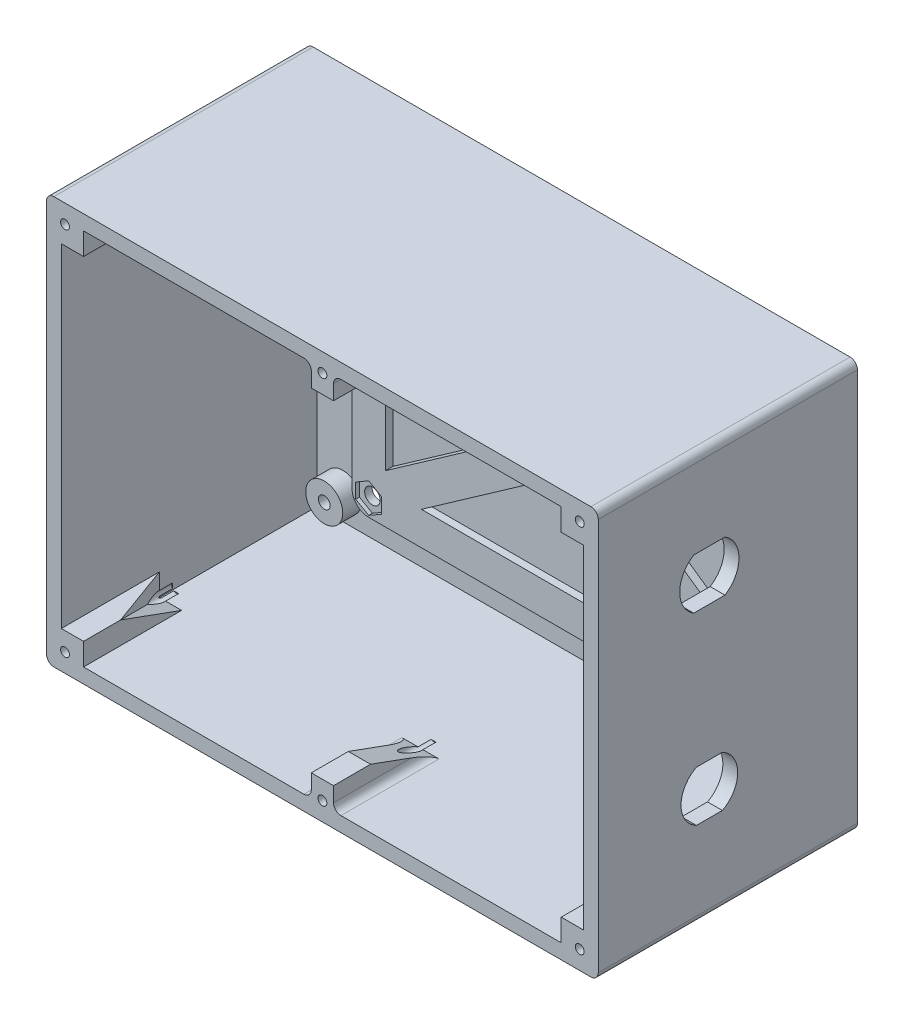
from build123d import *
from OCP.BRepFilletAPI import BRepFilletAPI_MakeChamfer

# Parameters (mm, degrees)
SKICA1_W                      = 149
SKICA1_H                      = 110
SKICA1_W_2                    = 141
SKICA1_H_2                    = 102
P_IDAT_VYSUNUT_M1_DEPTH       = 70
SKICA1_3_W                    = 141
SKICA1_3_H                    = 102
P_IDAT_VYSUNUT_M2_DEPTH       = 1
SKICA2_R                      = 5
SKICA2_R_2                    = 1.6
P_IDAT_VYSUNUT_M3_DEPTH       = 5
ODEBRAT_VYSUNUT_M1_DEPTH      = 129.926335556
ODEBRAT_VYSUNUT_M1_DEPTH_BACK = 129.926335556
SKICA2_2_R                    = 1.6
ODEBRAT_VYSUNUT_M2_DEPTH      = 4
SKICA7_R                      = 2.1
P_IDAT_VYSUNUT_M4_DEPTH       = 2
SKICA7_2_R                    = 2.1
ODEBRAT_VYSUNUT_M3_DEPTH      = 129.926335556
ODEBRAT_VYSUNUT_M4_DEPTH      = 1
ODEBRAT_VYSUNUT_M5_DEPTH      = 2.5
SKICA10_W                     = 6
SKICA10_H                     = 6
P_IDAT_VYSUNUT_M5_DEPTH       = 10
ZKOSEN_1_SIZE                 = 16.484864517
ZKOSEN_1_SIZE_2               = 6
SKICA11_R                     = 1.2
ODEBRAT_VYSUNUT_M6_DEPTH      = 30
ZAOBLIT1_R                    = 2
ZAOBLIT2_R                    = 2


with BuildPart() as part:
    # Skica1 → Přidat vysunutím1 (new body)
    with BuildSketch(Plane.XY):
        with Locations((19.5, 0)):
            Rectangle(SKICA1_W, SKICA1_H)
        with Locations((19.5, 0)):
            Rectangle(SKICA1_W_2, SKICA1_H_2, mode=Mode.SUBTRACT)
    extrude(amount=P_IDAT_VYSUNUT_M1_DEPTH)

    # Skica1<3> → Přidat vysunutím2 (add)
    with BuildSketch(Plane.XY):
        with Locations((19.5, 0)):
            Rectangle(SKICA1_3_W, SKICA1_3_H)
    extrude(amount=P_IDAT_VYSUNUT_M2_DEPTH)

    # Skica2 → Přidat vysunutím3 (add)
    # profile 1 of 4: a face of its own
    with BuildSketch(Plane.XY.offset(1)):
        with Locations((-44, 44)):
            Circle(SKICA2_R)
        with Locations((-44, 44)):
            Circle(SKICA2_R_2, mode=Mode.SUBTRACT)
    # profile 2 of 4: a face of its own
    with BuildSketch(Plane.XY.offset(1)):
        with Locations((44, 44)):
            Circle(SKICA2_R)
        with Locations((44, 44)):
            Circle(SKICA2_R_2, mode=Mode.SUBTRACT)
    # profile 3 of 4: a face of its own
    with BuildSketch(Plane.XY.offset(1)):
        with Locations((44, -44)):
            Circle(SKICA2_R)
        with Locations((44, -44)):
            Circle(SKICA2_R_2, mode=Mode.SUBTRACT)
    # profile 4 of 4: a face of its own
    with BuildSketch(Plane.XY.offset(1)):
        with Locations((-44, -44)):
            Circle(SKICA2_R)
        with Locations((-44, -44)):
            Circle(SKICA2_R_2, mode=Mode.SUBTRACT)
    extrude(amount=P_IDAT_VYSUNUT_M3_DEPTH)

    # Skica2<2> → Odebrat vysunutím1 (cut, two sides: drawn at the far end of the back side and taken through both)
    with BuildSketch(Plane.XY.offset(1).offset(-ODEBRAT_VYSUNUT_M1_DEPTH_BACK)):
        with Locations((-44, 44)):
            Circle(SKICA2_2_R)
        with Locations((44, 44)):
            Circle(SKICA2_2_R)
        with Locations((44, -44)):
            Circle(SKICA2_2_R)
        with Locations((-44, -44)):
            Circle(SKICA2_2_R)
    extrude(amount=ODEBRAT_VYSUNUT_M1_DEPTH + ODEBRAT_VYSUNUT_M1_DEPTH_BACK, mode=Mode.SUBTRACT)

    # Skica6 → Odebrat vysunutím2 (cut)
    with BuildSketch(Plane(origin=(94, 0, 0), x_dir=(0, 0, -1), z_dir=(1, 0, 0))):
        with BuildLine():
            Line((-44.214261501, 31.8), (-35.785738499, 31.8))
            ThreePointArc((-35.785738499, 31.8), (-32, 25), (-35.785738499, 18.2))
            Line((-35.785738499, 18.2), (-44.214261501, 18.2))
            ThreePointArc((-44.214261501, 18.2), (-48, 25), (-44.214261501, 31.8))
        make_face()
        with BuildLine():
            Line((-43.504639782, -18.2), (-36.495360218, -18.2))
            ThreePointArc((-36.495360218, -18.2), (-32.35, -25), (-36.495360218, -31.8))
            Line((-36.495360218, -31.8), (-43.504639782, -31.8))
            ThreePointArc((-43.504639782, -31.8), (-47.65, -25), (-43.504639782, -18.2))
        make_face()
    extrude(amount=-ODEBRAT_VYSUNUT_M2_DEPTH, mode=Mode.SUBTRACT)

    # Skica7 → Přidat vysunutím4 (add)
    with BuildSketch(Plane.XY.offset(1)):
        with BuildLine():
            Line((-39.5, 40), (-39.5, -40))
            ThreePointArc((-39.5, -40), (-38.181980515, -43.181980515), (-35, -44.5))
            Line((-35, -44.5), (39.025062814, -44.5))
            ThreePointArc((39.025062814, -44.5), (44, -39), (48.974937186, -44.5))
            Line((48.974937186, -44.5), (79, -44.5))
            ThreePointArc((79, -44.5), (82.181980515, -43.181980515), (83.5, -40))
            Line((83.5, -40), (83.5, 40))
            ThreePointArc((83.5, 40), (82.181980515, 43.181980515), (79, 44.5))
            Line((79, 44.5), (48.974937186, 44.5))
            ThreePointArc((48.974937186, 44.5), (44, 39), (39.025062814, 44.5))
            Line((39.025062814, 44.5), (-35, 44.5))
            ThreePointArc((-35, 44.5), (-38.181980515, 43.181980515), (-39.5, 40))
        make_face()
        with Locations((-35, 40)):
            Circle(SKICA7_R, mode=Mode.SUBTRACT)
        with Locations((79, 40)):
            Circle(SKICA7_R, mode=Mode.SUBTRACT)
        with Locations((79, -40)):
            Circle(SKICA7_R, mode=Mode.SUBTRACT)
        with Locations((-35, -40)):
            Circle(SKICA7_R, mode=Mode.SUBTRACT)
        Polygon((74.5, -31.344624097), (29.833910661, 0), (74.5, 31.344624097), align=None, mode=Mode.SUBTRACT)
        Polygon((64.753589339, 35.5), (22, 5.497481166), (-20.753589339, 35.5), align=None, mode=Mode.SUBTRACT)
        Polygon((-20.753589339, -35.5), (22, -5.497481166), (64.753589339, -35.5), align=None, mode=Mode.SUBTRACT)
        Polygon((-30.5, -31.344624097), (-30.5, 31.344624097), (14.166089339, 0), align=None, mode=Mode.SUBTRACT)
    extrude(amount=P_IDAT_VYSUNUT_M4_DEPTH)

    # Skica7<2> → Odebrat vysunutím3 (cut, through all)
    with BuildSketch(Plane.XY.offset(1)):
        with Locations((-35, 40)):
            Circle(SKICA7_2_R)
        with Locations((79, 40)):
            Circle(SKICA7_2_R)
        with Locations((79, -40)):
            Circle(SKICA7_2_R)
        with Locations((-35, -40)):
            Circle(SKICA7_2_R)
    extrude(amount=-ODEBRAT_VYSUNUT_M3_DEPTH, mode=Mode.SUBTRACT)

    # Skica8 → Odebrat vysunutím4 (cut)
    with BuildSketch(Plane.XY.offset(3)):
        Polygon((-35, 35.958548116), (-31.5, 37.979274058), (-31.5, 42.020725942), (-35, 44.041451884), (-38.5, 42.020725942), (-38.5, 37.979274058), align=None)
        Polygon((-35, -35.958548116), (-38.5, -37.979274058), (-38.5, -42.020725942), (-35, -44.041451884), (-31.5, -42.020725942), (-31.5, -37.979274058), align=None)
        Polygon((79, -35.958548116), (75.5, -37.979274058), (75.5, -42.020725942), (79, -44.041451884), (82.5, -42.020725942), (82.5, -37.979274058), align=None)
        Polygon((79, 35.958548116), (82.5, 37.979274058), (82.5, 42.020725942), (79, 44.041451884), (75.5, 42.020725942), (75.5, 37.979274058), align=None)
    extrude(amount=-ODEBRAT_VYSUNUT_M4_DEPTH, mode=Mode.SUBTRACT)

    # Skica9 → Odebrat vysunutím5 (cut)
    with BuildSketch(Plane(origin=(0, 0, 0), x_dir=(-1, 0, 0), z_dir=(0, 0, -1))):
        Polygon((-44, 40.824573519), (-41.25, 42.41228676), (-41.25, 45.58771324), (-44, 47.175426481), (-46.75, 45.58771324), (-46.75, 42.41228676), align=None)
        Polygon((-44, -47.175426481), (-41.25, -45.58771324), (-41.25, -42.41228676), (-44, -40.824573519), (-46.75, -42.41228676), (-46.75, -45.58771324), align=None)
        Polygon((44, -47.175426481), (46.75, -45.58771324), (46.75, -42.41228676), (44, -40.824573519), (41.25, -42.41228676), (41.25, -45.58771324), align=None)
        Polygon((44, 40.824573519), (46.75, 42.41228676), (46.75, 45.58771324), (44, 47.175426481), (41.25, 45.58771324), (41.25, 42.41228676), align=None)
    extrude(amount=-ODEBRAT_VYSUNUT_M5_DEPTH, mode=Mode.SUBTRACT)

    # Skica10 → Přidat vysunutím5 (add)
    with BuildSketch(Plane.XY.offset(70)):
        with Locations((-48, 48)):
            Rectangle(SKICA10_W, SKICA10_H)
        with Locations((87, 48)):
            Rectangle(SKICA10_W, SKICA10_H)
        with Locations((87, -48)):
            Rectangle(SKICA10_W, SKICA10_H)
        with Locations((-48, -48)):
            Rectangle(SKICA10_W, SKICA10_H)
        with Locations((19.5, 48)):
            Rectangle(SKICA10_W, SKICA10_H)
        with Locations((19.5, -48)):
            Rectangle(SKICA10_W, SKICA10_H)
    extrude(amount=-P_IDAT_VYSUNUT_M5_DEPTH)

    # Zkosení1
    zkosen_1_edges_1 = [part.edges().sort_by_distance(p)[0] for p in [
        (-51, 48, 60),
    ]]
    zkosen_1_side_1 = [part.faces().sort_by_distance(p)[0] for p in [
        (-51, 48, 59.88),
    ]]
    zkosen_1_edges_2 = [part.edges().sort_by_distance(p)[0] for p in [
        (-48, 51, 60),
    ]]
    zkosen_1_side_2 = [part.faces().sort_by_distance(p)[0] for p in [
        (-48, 51, 59.88),
    ]]
    zkosen_1_edges_3 = [part.edges().sort_by_distance(p)[0] for p in [
        (-48, -51, 60),
    ]]
    zkosen_1_side_3 = [part.faces().sort_by_distance(p)[0] for p in [
        (-48, -51, 59.88),
    ]]
    zkosen_1_edges_4 = [part.edges().sort_by_distance(p)[0] for p in [
        (-51, -48, 60),
    ]]
    zkosen_1_side_4 = [part.faces().sort_by_distance(p)[0] for p in [
        (-51, -48, 59.88),
    ]]
    zkosen_1_edges_5 = [part.edges().sort_by_distance(p)[0] for p in [
        (19.5, 51, 60),
    ]]
    zkosen_1_side_5 = [part.faces().sort_by_distance(p)[0] for p in [
        (19.5, 51, 59.88),
    ]]
    zkosen_1_edges_6 = [part.edges().sort_by_distance(p)[0] for p in [
        (19.5, -51, 60),
    ]]
    zkosen_1_side_6 = [part.faces().sort_by_distance(p)[0] for p in [
        (19.5, -51, 59.88),
    ]]
    zkosen_1_edges_7 = [part.edges().sort_by_distance(p)[0] for p in [
        (90, -48, 60),
    ]]
    zkosen_1_side_7 = [part.faces().sort_by_distance(p)[0] for p in [
        (90, -48, 59.88),
    ]]
    zkosen_1_edges_8 = [part.edges().sort_by_distance(p)[0] for p in [
        (87, -51, 60),
    ]]
    zkosen_1_side_8 = [part.faces().sort_by_distance(p)[0] for p in [
        (87, -51, 59.88),
    ]]
    zkosen_1_edges_9 = [part.edges().sort_by_distance(p)[0] for p in [
        (87, 51, 60),
    ]]
    zkosen_1_side_9 = [part.faces().sort_by_distance(p)[0] for p in [
        (87, 51, 59.88),
    ]]
    zkosen_1_edges_10 = [part.edges().sort_by_distance(p)[0] for p in [
        (90, 48, 60),
    ]]
    zkosen_1_side_10 = [part.faces().sort_by_distance(p)[0] for p in [
        (90, 48, 59.88),
    ]]
    zkosen_1 = BRepFilletAPI_MakeChamfer(part.part.solid().wrapped)
    for e in zkosen_1_edges_1:
        zkosen_1.Add(ZKOSEN_1_SIZE - 0.0001, ZKOSEN_1_SIZE_2 - 0.0001, e.wrapped, zkosen_1_side_1[0].wrapped)
    for e in zkosen_1_edges_2:
        zkosen_1.Add(ZKOSEN_1_SIZE - 0.0001, ZKOSEN_1_SIZE_2 - 0.0001, e.wrapped, zkosen_1_side_2[0].wrapped)
    for e in zkosen_1_edges_3:
        zkosen_1.Add(ZKOSEN_1_SIZE - 0.0001, ZKOSEN_1_SIZE_2 - 0.0001, e.wrapped, zkosen_1_side_3[0].wrapped)
    for e in zkosen_1_edges_4:
        zkosen_1.Add(ZKOSEN_1_SIZE - 0.0001, ZKOSEN_1_SIZE_2 - 0.0001, e.wrapped, zkosen_1_side_4[0].wrapped)
    for e in zkosen_1_edges_5:
        zkosen_1.Add(ZKOSEN_1_SIZE - 0.0001, ZKOSEN_1_SIZE_2 - 0.0001, e.wrapped, zkosen_1_side_5[0].wrapped)
    for e in zkosen_1_edges_6:
        zkosen_1.Add(ZKOSEN_1_SIZE - 0.0001, ZKOSEN_1_SIZE_2 - 0.0001, e.wrapped, zkosen_1_side_6[0].wrapped)
    for e in zkosen_1_edges_7:
        zkosen_1.Add(ZKOSEN_1_SIZE - 0.0001, ZKOSEN_1_SIZE_2 - 0.0001, e.wrapped, zkosen_1_side_7[0].wrapped)
    for e in zkosen_1_edges_8:
        zkosen_1.Add(ZKOSEN_1_SIZE - 0.0001, ZKOSEN_1_SIZE_2 - 0.0001, e.wrapped, zkosen_1_side_8[0].wrapped)
    for e in zkosen_1_edges_9:
        zkosen_1.Add(ZKOSEN_1_SIZE - 0.0001, ZKOSEN_1_SIZE_2 - 0.0001, e.wrapped, zkosen_1_side_9[0].wrapped)
    for e in zkosen_1_edges_10:
        zkosen_1.Add(ZKOSEN_1_SIZE - 0.0001, ZKOSEN_1_SIZE_2 - 0.0001, e.wrapped, zkosen_1_side_10[0].wrapped)
    add(Compound.cast(zkosen_1.Shape()), mode=Mode.REPLACE)  # a hair under: the kernel refuses the full size

    # Skica11 → Odebrat vysunutím6 (cut)
    with BuildSketch(Plane.XY.offset(70)):
        with Locations((-50, 50)):
            Circle(SKICA11_R)
        with Locations((19.5, 50)):
            Circle(SKICA11_R)
        with Locations((89, 50)):
            Circle(SKICA11_R)
        with Locations((89, -50)):
            Circle(SKICA11_R)
        with Locations((19.5, -50)):
            Circle(SKICA11_R)
        with Locations((-50, -50)):
            Circle(SKICA11_R)
    extrude(amount=-ODEBRAT_VYSUNUT_M6_DEPTH, mode=Mode.SUBTRACT)

    # Zaoblit1
    zaoblit1_edges = [part.edges().sort_by_distance(p)[0] for p in [
        (-55, 55, 35),
        (94, 55, 35),
        (94, -55, 35),
        (-55, -55, 35),
    ]]
    fillet(zaoblit1_edges, radius=ZAOBLIT1_R)

    # Zaoblit2
    zaoblit2_edges = [part.edges().sort_by_distance(p)[0] for p in [
        (16.5, 51, 56.757617741),
        (22.5, 51, 56.757617741),
        (22.5, -51, 56.757617741),
        (16.5, -51, 56.757617741),
    ]]
    fillet(zaoblit2_edges, radius=ZAOBLIT2_R)


solid = part.part
